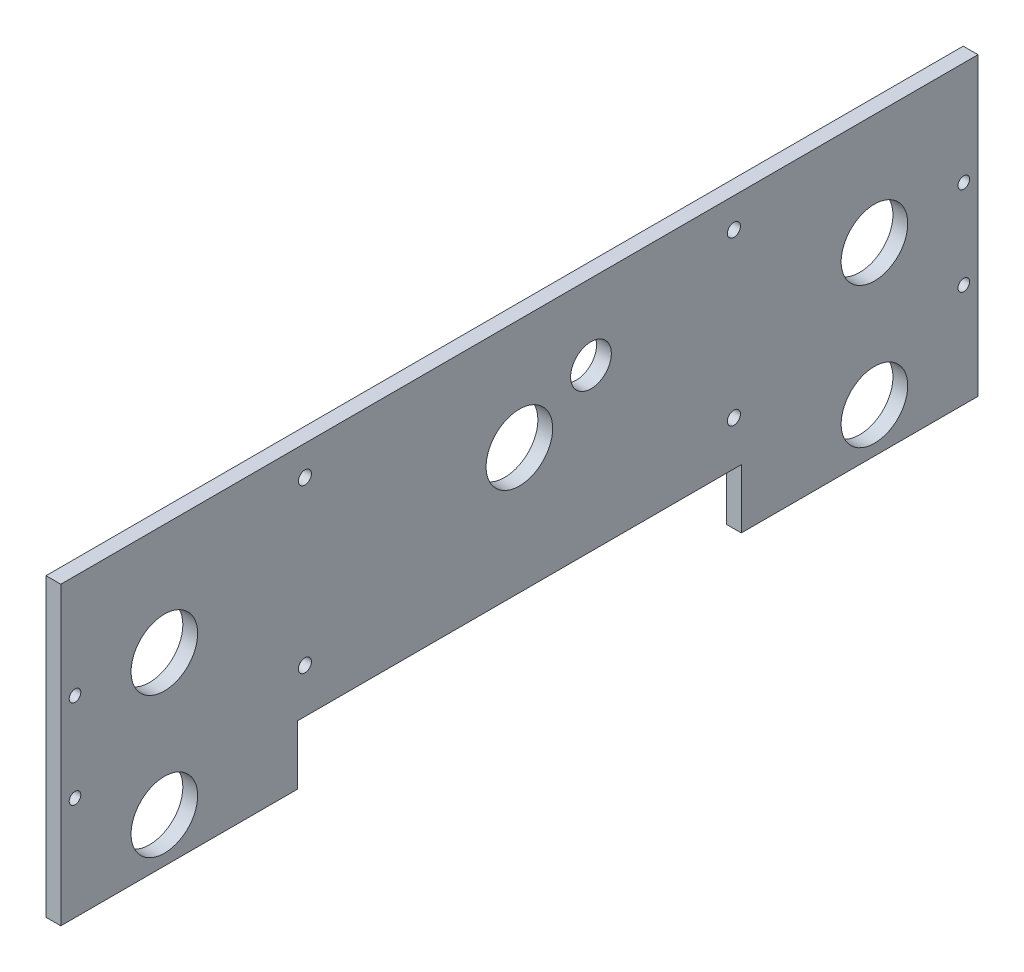
from build123d import *

# Parameters (mm, degrees)
SKETCH1_W                                       = 393.7
SKETCH1_H                                       = 127
BOSS_EXTRUDE1_DEPTH                             = 6.35
SKETCH2_R                                       = 14.2875
SKETCH2_R_2                                     = 8.750046
CUT_EXTRUDE1_DEPTH                              = 207.935968357
F_10_CLEARANCE_HOLE1_D                          = 4.9784
SKETCH23_W                                      = 190.5
SKETCH23_H                                      = 25.4
CUT_EXTRUDE6_DEPTH                              = 207.935968357
CSK_FOR_10_FLAT_HEAD_MACHINE_SCREW2_D           = 5.6134
CSK_FOR_10_FLAT_HEAD_MACHINE_SCREW2_CSINK_D     = 9.779
CSK_FOR_10_FLAT_HEAD_MACHINE_SCREW2_CSINK_ANGLE = 82


with BuildPart() as part:
    # Sketch1 → Boss-Extrude1 (new body)
    with BuildSketch(Plane(origin=(0, 0, 0), x_dir=(0, 0, -1), z_dir=(1, 0, 0))):
        Rectangle(SKETCH1_W, SKETCH1_H)
    extrude(amount=BOSS_EXTRUDE1_DEPTH)

    # Sketch2 → Cut-Extrude1 (cut, through all)
    with BuildSketch(Plane(origin=(6.35, 0, 0), x_dir=(0, 0, -1), z_dir=(1, 0, 0))):
        with Locations((0, 15.875)):
            Circle(SKETCH2_R)
        with Locations((-152.4, 15.875)):
            Circle(SKETCH2_R)
        with Locations((152.4, 15.875)):
            Circle(SKETCH2_R)
        with Locations((-152.4, -44.45)):
            Circle(SKETCH2_R)
        with Locations((152.4, -44.45)):
            Circle(SKETCH2_R)
        with Locations((30.717202021, 31.115)):
            Circle(SKETCH2_R_2)
    extrude(amount=-CUT_EXTRUDE1_DEPTH, mode=Mode.SUBTRACT)

    # #10 Clearance Hole1 (through all)
    with Locations(Plane(origin=(6.35, 0, 0), x_dir=(0, 0, -1), z_dir=(1, 0, 0))):
        with Locations((-190.754, 19.05), (-190.754, -19.05), (190.754, 19.05), (190.754, -19.05)):
            Hole(F_10_CLEARANCE_HOLE1_D / 2)

    # Sketch23 → Cut-Extrude6 (cut, through all)
    with BuildSketch(Plane(origin=(6.35, 0, 0), x_dir=(0, 0, -1), z_dir=(1, 0, 0))):
        with Locations((0, -50.8)):
            Rectangle(SKETCH23_W, SKETCH23_H)
    extrude(amount=-CUT_EXTRUDE6_DEPTH, mode=Mode.SUBTRACT)

    # CSK for #10 Flat Head Machine Screw2 (through all)
    with Locations(Plane.ZY):
        with Locations((-92.075, 50.8), (-92.075, -19.05), (92.075, -19.05), (92.075, 50.8)):
            CounterSinkHole(CSK_FOR_10_FLAT_HEAD_MACHINE_SCREW2_D / 2, CSK_FOR_10_FLAT_HEAD_MACHINE_SCREW2_CSINK_D / 2, counter_sink_angle=CSK_FOR_10_FLAT_HEAD_MACHINE_SCREW2_CSINK_ANGLE)


solid = part.part
